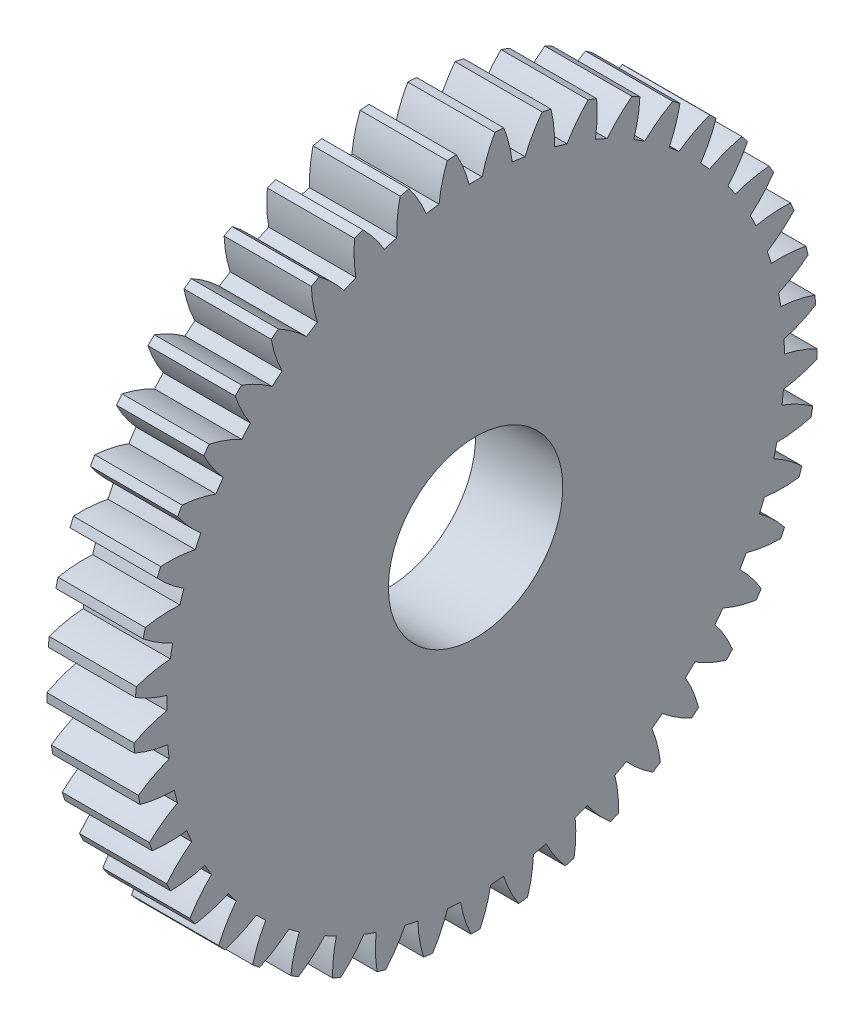
from build123d import *

# Parameters (mm, degrees)
BASPROSKE_W        = 6.35
BASPROSKE_H        = 24.870833333
TOOTHCUT_DEPTH     = 36.741281474
TEETHCUTS_COUNT    = 45
TEETHCUTS_ANGLE    = 352
BORSKE_R           = 0.396875
BORE_DEPTH         = 50.8000508
SKETCH1_R          = 6.35
CUT_EXTRUDE1_DEPTH = 36.737184219


with BuildPart() as part:
    # BasProSke → Base-Revolve (revolve)
    with BuildSketch(Plane(origin=(0, 0, 0), x_dir=(1, 0, 0), z_dir=(0, 1, 0))):
        with Locations((3.175, 12.435416667)):
            Rectangle(BASPROSKE_W, BASPROSKE_H)
    revolve(axis=Axis((-10, 0, 0), (1, 0, 0)))

    # TooCutSke → ToothCut (cut, through all)
    with BuildSketch(Plane(origin=(0, 0, 0), x_dir=(0, 0, -1), z_dir=(1, 0, 0))):
        with BuildLine():
            ThreePointArc((0.473265831, 22.486720266), (0, 22.4917), (-0.473265831, 22.486720266))
            ThreePointArc((-0.473265831, 22.486720266), (-0.868206775, 23.703075009), (-1.422532312, 24.855559459))
            ThreePointArc((-1.422532312, 24.855559459), (0, 24.896233333), (1.422532312, 24.855559459))
            ThreePointArc((1.422532312, 24.855559459), (0.868206775, 23.703075009), (0.473265831, 22.486720266))
        make_face()
    toothcut = extrude(amount=TOOTHCUT_DEPTH, mode=Mode.SUBTRACT)

    # TeethCuts: ToothCut ×45 about axis
    teethcuts_axis = Axis((-10, 0, 0), (1, 0, 0))
    for i in range(1, TEETHCUTS_COUNT):
        add(toothcut.rotate(teethcuts_axis, i * TEETHCUTS_ANGLE / (TEETHCUTS_COUNT - 1)), mode=Mode.SUBTRACT)

    # BorSke → Bore (cut, symmetric)
    with BuildSketch(Plane(origin=(0, 0, 0), x_dir=(0, 0, -1), z_dir=(1, 0, 0))):
        Circle(BORSKE_R)
    extrude(amount=BORE_DEPTH, both=True, mode=Mode.SUBTRACT)

    # Sketch1 → Cut-Extrude1 (cut, through all)
    with BuildSketch(Plane.ZY):
        Circle(SKETCH1_R)
    extrude(amount=-CUT_EXTRUDE1_DEPTH, mode=Mode.SUBTRACT)


solid = part.part
